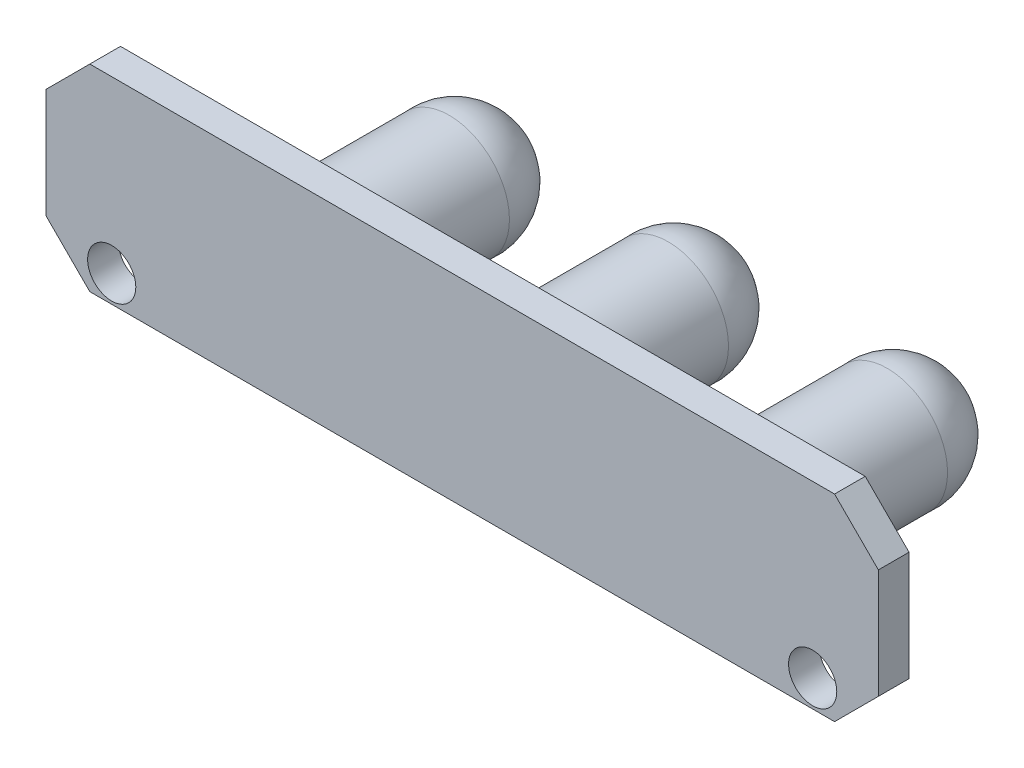
from build123d import *

# Parameters (mm, degrees)
ESQUISSE1_W       = 38
ESQUISSE1_H       = 9
ESQUISSE1_R       = 1.1
EXTRUSION1_DEPTH  = 1.4
CHANFREIN1_SIZE   = 2
ESQUISSE3_R       = 2.75
EXTRUSION2_DEPTH  = 8
D_ME1_FACE_RADIUS = 2.75
D_ME1_HEIGHT      = 3
D_ME2_FACE_RADIUS = 2.75
D_ME2_HEIGHT      = 3


# Read off the part's stored shape, not the designer's step: Dôme3
with BuildPart() as part:
    # Esquisse1 → Extrusion1 (new body)
    with BuildSketch(Plane.XY):
        with Locations((0, 12.855949766)):
            Rectangle(ESQUISSE1_W, ESQUISSE1_H)
        with Locations((16, 9.584679883)):
            Circle(ESQUISSE1_R, mode=Mode.SUBTRACT)
        with Locations((-16, 9.584679883)):
            Circle(ESQUISSE1_R, mode=Mode.SUBTRACT)
    extrude(amount=EXTRUSION1_DEPTH)

    # Chanfrein1
    chanfrein1_edges = [part.edges().sort_by_distance(p)[0] for p in [
        (-19, 17.355949766, 0.7),
        (19, 17.355949766, 0.7),
        (19, 8.355949766, 0.7),
        (-19, 8.355949766, 0.7),
    ]]
    chamfer(chanfrein1_edges, length=CHANFREIN1_SIZE)

    # Esquisse3 → Extrusion2 (add)
    with BuildSketch(Plane(origin=(0, 0, 0), x_dir=(-1, 0, 0), z_dir=(0, 0, -1))):
        with Locations((-10.007204419, 11.380286636)):
            Circle(ESQUISSE3_R)
        with Locations((-0.007204739, 11.382819166)):
            Circle(ESQUISSE3_R)
        with Locations((9.99279494, 11.385351696)):
            Circle(ESQUISSE3_R)
    extrude(amount=EXTRUSION2_DEPTH)

    # Dôme1: a dome of height H over a round flat face of radius A is a cap of a sphere of radius (A * A + H * H) / (2 * H)
    d_me1_r = (D_ME1_FACE_RADIUS * D_ME1_FACE_RADIUS + D_ME1_HEIGHT * D_ME1_HEIGHT) / (2 * D_ME1_HEIGHT)
    d_me1_base = Plane((-9.99279494, 11.385351696, -8), z_dir=(0, 0, -1))
    with Locations(d_me1_base.offset(D_ME1_HEIGHT - d_me1_r)):
        d_me1_ball = Sphere(d_me1_r, mode=Mode.PRIVATE)
    add(split(d_me1_ball, bisect_by=d_me1_base, keep=Keep.TOP, mode=Mode.PRIVATE))

    # Dôme2: a dome of height H over a round flat face of radius A is a cap of a sphere of radius (A * A + H * H) / (2 * H)
    d_me2_r = (D_ME2_FACE_RADIUS * D_ME2_FACE_RADIUS + D_ME2_HEIGHT * D_ME2_HEIGHT) / (2 * D_ME2_HEIGHT)
    d_me2_base = Plane((0.007204739, 11.382819166, -8), z_dir=(0, 0, -1))
    with Locations(d_me2_base.offset(D_ME2_HEIGHT - d_me2_r)):
        d_me2_ball = Sphere(d_me2_r, mode=Mode.PRIVATE)
    add(split(d_me2_ball, bisect_by=d_me2_base, keep=Keep.TOP, mode=Mode.PRIVATE))

    # Dôme3 outline → Dôme3 (revolve)
    with BuildSketch(Plane(origin=(10.007204419, 11.380286636, 0), x_dir=(1, 0, 0), z_dir=(0, -1, 0))):
        with BuildLine():
            Line((0, -7.999999997), (0, -11))
            ThreePointArc((0, -11), (2.034852575, -10.104864859), (2.75, -7.999999998))
            Line((2.75, -7.999999998), (0, -7.999999997))
        make_face()
    revolve(axis=Axis((10.007204419, 11.380286636, 0), (0, 0, 1)))


solid = part.part
